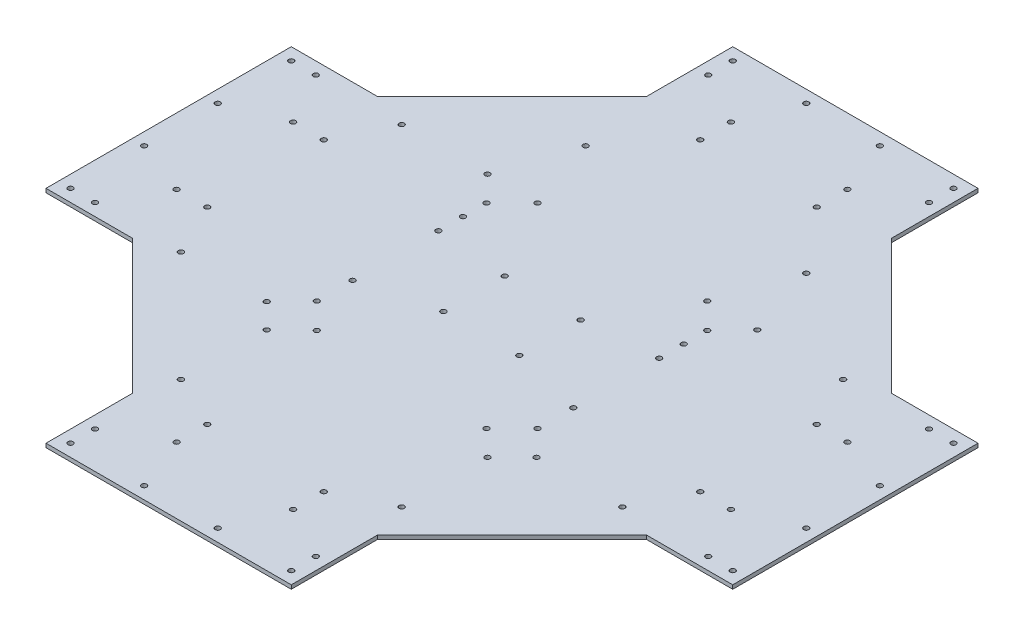
from build123d import *

# Parameters (mm, degrees)
SKETCH1_R           = 2.125
BOSS_EXTRUDE1_DEPTH = 3.175
SKETCH2_R           = 2.125
CUT_EXTRUDE1_DEPTH  = 396.992525971


with BuildPart() as part:
    # Sketch1 → Boss-Extrude1 (new body)
    with BuildSketch(Plane(origin=(0, 0, 0), x_dir=(1, 0, 0), z_dir=(0, 1, 0))):
        Polygon((-100, -280), (0, -280), (100, -280), (100, -209.601551084), (209.601551084, -100), (280, -100), (280, 0), (280, 100), (209.601551084, 100), (100, 209.601551084), (100, 280), (0, 280), (-100, 280), (-100, 209.601551084), (-209.601551084, 100), (-280, 100), (-280, 0), (-280, -100), (-209.601551084, -100), (-100, -209.601551084), align=None)
        with Locations((-90, -270)):
            Circle(SKETCH1_R, mode=Mode.SUBTRACT)
        with Locations((-90, -250)):
            Circle(SKETCH1_R, mode=Mode.SUBTRACT)
        with Locations((-30, -270)):
            Circle(SKETCH1_R, mode=Mode.SUBTRACT)
        with Locations((-47.5, -226)):
            Circle(SKETCH1_R, mode=Mode.SUBTRACT)
        with Locations((-90, -180)):
            Circle(SKETCH1_R, mode=Mode.SUBTRACT)
        with Locations((-47.5, -201)):
            Circle(SKETCH1_R, mode=Mode.SUBTRACT)
        with Locations((-270, -90)):
            Circle(SKETCH1_R, mode=Mode.SUBTRACT)
        with Locations((-250, -90)):
            Circle(SKETCH1_R, mode=Mode.SUBTRACT)
        with Locations((-180, -90)):
            Circle(SKETCH1_R, mode=Mode.SUBTRACT)
        with Locations((-226, -47.5)):
            Circle(SKETCH1_R, mode=Mode.SUBTRACT)
        with Locations((-270, -30)):
            Circle(SKETCH1_R, mode=Mode.SUBTRACT)
        with Locations((-201, -47.5)):
            Circle(SKETCH1_R, mode=Mode.SUBTRACT)
        with Locations((-90, -110)):
            Circle(SKETCH1_R, mode=Mode.SUBTRACT)
        with Locations((-110, -90)):
            Circle(SKETCH1_R, mode=Mode.SUBTRACT)
        with Locations((-90, -40)):
            Circle(SKETCH1_R, mode=Mode.SUBTRACT)
        with Locations((30, -270)):
            Circle(SKETCH1_R, mode=Mode.SUBTRACT)
        with Locations((47.5, -226)):
            Circle(SKETCH1_R, mode=Mode.SUBTRACT)
        with Locations((90, -270)):
            Circle(SKETCH1_R, mode=Mode.SUBTRACT)
        with Locations((90, -250)):
            Circle(SKETCH1_R, mode=Mode.SUBTRACT)
        with Locations((47.5, -201)):
            Circle(SKETCH1_R, mode=Mode.SUBTRACT)
        with Locations((90, -180)):
            Circle(SKETCH1_R, mode=Mode.SUBTRACT)
        with Locations((90, -110)):
            Circle(SKETCH1_R, mode=Mode.SUBTRACT)
        with Locations((110, -90)):
            Circle(SKETCH1_R, mode=Mode.SUBTRACT)
        with Locations((90, -40)):
            Circle(SKETCH1_R, mode=Mode.SUBTRACT)
        with Locations((180, -90)):
            Circle(SKETCH1_R, mode=Mode.SUBTRACT)
        with Locations((250, -90)):
            Circle(SKETCH1_R, mode=Mode.SUBTRACT)
        with Locations((270, -90)):
            Circle(SKETCH1_R, mode=Mode.SUBTRACT)
        with Locations((201, -47.5)):
            Circle(SKETCH1_R, mode=Mode.SUBTRACT)
        with Locations((226, -47.5)):
            Circle(SKETCH1_R, mode=Mode.SUBTRACT)
        with Locations((270, -30)):
            Circle(SKETCH1_R, mode=Mode.SUBTRACT)
        with Locations((-270, 30)):
            Circle(SKETCH1_R, mode=Mode.SUBTRACT)
        with Locations((-226, 47.5)):
            Circle(SKETCH1_R, mode=Mode.SUBTRACT)
        with Locations((-201, 47.5)):
            Circle(SKETCH1_R, mode=Mode.SUBTRACT)
        with Locations((-270, 90)):
            Circle(SKETCH1_R, mode=Mode.SUBTRACT)
        with Locations((-250, 90)):
            Circle(SKETCH1_R, mode=Mode.SUBTRACT)
        with Locations((-180, 90)):
            Circle(SKETCH1_R, mode=Mode.SUBTRACT)
        with Locations((-90, 30)):
            Circle(SKETCH1_R, mode=Mode.SUBTRACT)
        with Locations((-90, 50)):
            Circle(SKETCH1_R, mode=Mode.SUBTRACT)
        with Locations((-110, 90)):
            Circle(SKETCH1_R, mode=Mode.SUBTRACT)
        with Locations((-90, 150)):
            Circle(SKETCH1_R, mode=Mode.SUBTRACT)
        with Locations((-47.5, 201)):
            Circle(SKETCH1_R, mode=Mode.SUBTRACT)
        with Locations((-90, 250)):
            Circle(SKETCH1_R, mode=Mode.SUBTRACT)
        with Locations((-90, 270)):
            Circle(SKETCH1_R, mode=Mode.SUBTRACT)
        with Locations((-47.5, 226)):
            Circle(SKETCH1_R, mode=Mode.SUBTRACT)
        with Locations((-30, 270)):
            Circle(SKETCH1_R, mode=Mode.SUBTRACT)
        with Locations((90, 30)):
            Circle(SKETCH1_R, mode=Mode.SUBTRACT)
        with Locations((90, 50)):
            Circle(SKETCH1_R, mode=Mode.SUBTRACT)
        with Locations((110, 90)):
            Circle(SKETCH1_R, mode=Mode.SUBTRACT)
        with Locations((201, 47.5)):
            Circle(SKETCH1_R, mode=Mode.SUBTRACT)
        with Locations((270, 30)):
            Circle(SKETCH1_R, mode=Mode.SUBTRACT)
        with Locations((226, 47.5)):
            Circle(SKETCH1_R, mode=Mode.SUBTRACT)
        with Locations((180, 90)):
            Circle(SKETCH1_R, mode=Mode.SUBTRACT)
        with Locations((250, 90)):
            Circle(SKETCH1_R, mode=Mode.SUBTRACT)
        with Locations((270, 90)):
            Circle(SKETCH1_R, mode=Mode.SUBTRACT)
        with Locations((47.5, 201)):
            Circle(SKETCH1_R, mode=Mode.SUBTRACT)
        with Locations((90, 150)):
            Circle(SKETCH1_R, mode=Mode.SUBTRACT)
        with Locations((47.5, 226)):
            Circle(SKETCH1_R, mode=Mode.SUBTRACT)
        with Locations((30, 270)):
            Circle(SKETCH1_R, mode=Mode.SUBTRACT)
        with Locations((90, 250)):
            Circle(SKETCH1_R, mode=Mode.SUBTRACT)
        with Locations((90, 270)):
            Circle(SKETCH1_R, mode=Mode.SUBTRACT)
    extrude(amount=BOSS_EXTRUDE1_DEPTH)

    # Sketch2 → Cut-Extrude1 (cut, through all)
    with BuildSketch(Plane(origin=(0, 3.175, 0), x_dir=(1, 0, 0), z_dir=(0, 1, 0))):
        with Locations((-31, 25)):
            Circle(SKETCH2_R)
        with Locations((-31, -25)):
            Circle(SKETCH2_R)
        with Locations((31, -25)):
            Circle(SKETCH2_R)
        with Locations((31, 25)):
            Circle(SKETCH2_R)
        with Locations((-90, 69.2)):
            Circle(SKETCH2_R)
        with Locations((-69.2, 90)):
            Circle(SKETCH2_R)
        with Locations((69.2, 90)):
            Circle(SKETCH2_R)
        with Locations((90, 69.2)):
            Circle(SKETCH2_R)
        with Locations((90, -69.2)):
            Circle(SKETCH2_R)
        with Locations((69.2, -90)):
            Circle(SKETCH2_R)
        with Locations((-69.2, -90)):
            Circle(SKETCH2_R)
        with Locations((-90, -69.2)):
            Circle(SKETCH2_R)
    extrude(amount=-CUT_EXTRUDE1_DEPTH, mode=Mode.SUBTRACT)


solid = part.part
